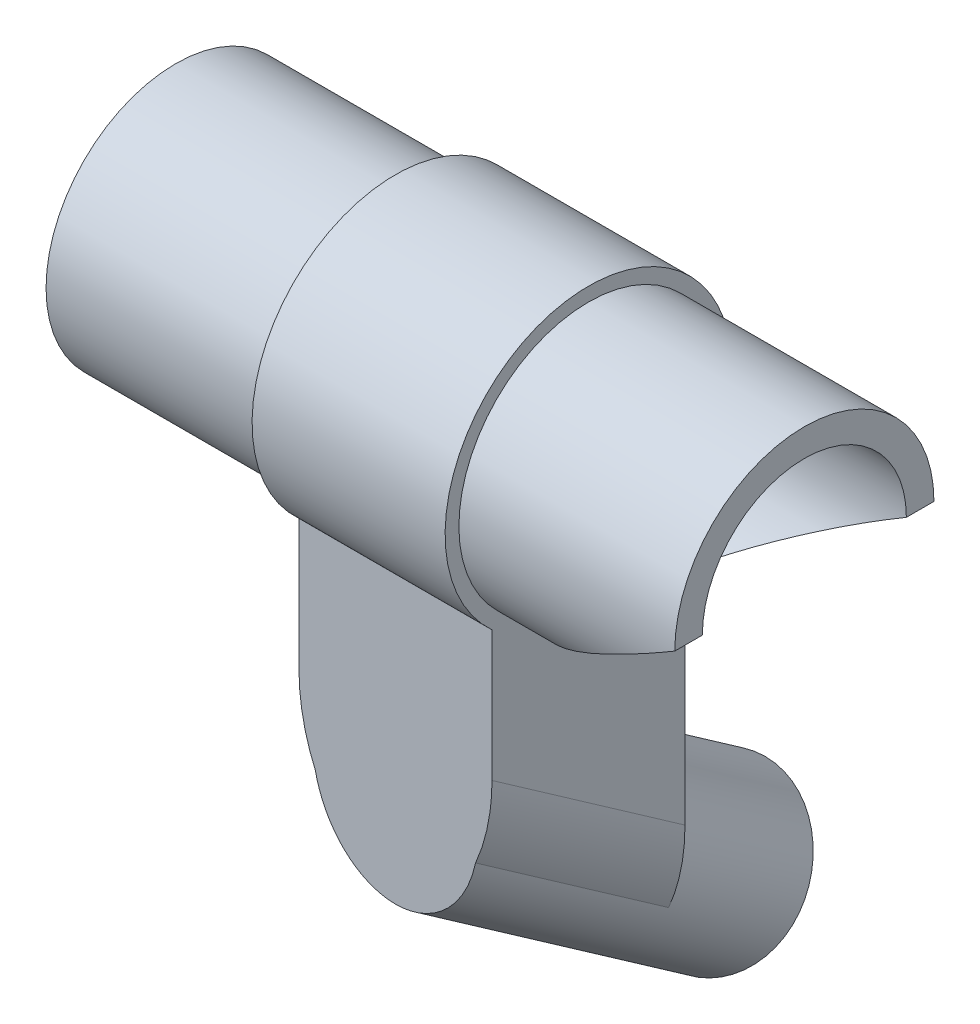
from build123d import *

# Parameters (mm, degrees)
CROQUIS1_R              = 23.5
CROQUIS1_R_2            = 18.5
SALIENTE_EXTRUIR1_DEPTH = 114
CROQUIS2_R              = 23.5
CROQUIS2_R_2            = 5.375
CROQUIS2_R_3            = 1.25
SALIENTE_EXTRUIR2_DEPTH = 5
CORTAR_EXTRUIR1_DEPTH   = 23.5
CROQUIS6_R              = 11.5
CORTAR_EXTRUIR2_DEPTH   = 2.5
CROQUIS17_W             = 35
CROQUIS17_H             = 35
SALIENTE_EXTRUIR3_DEPTH = 65
CROQUIS18_R             = 15
CROQUIS18_R_2           = 12.5
SALIENTE_EXTRUIR4_DEPTH = 70
CROQUIS26_W             = 35
CROQUIS26_H             = 35
SALIENTE_EXTRUIR8_DEPTH = 40
CORTAR_EXTRUIR4_DEPTH   = 167.48351172
CROQUIS27_R             = 26
SALIENTE_EXTRUIR9_DEPTH = 35
CORTAR_EXTRUIR7_START   = -35
CROQUIS28_R             = 18.5
CORTAR_EXTRUIR7_DEPTH   = 35
CROQUIS25_W             = 17.40616007
CROQUIS25_H             = 44.473979809
CORTAR_EXTRUIR8_DEPTH   = 35
REDONDEO7_R             = 25


with BuildPart() as part:
    # Croquis1 → Saliente-Extruir1 (new body)
    with BuildSketch(Plane(origin=(0, 0, 0), x_dir=(0, 0, -1), z_dir=(1, 0, 0))):
        with Locations(Location((0, 0, 0), (0, 0, 180))):
            Circle(CROQUIS1_R)
        with Locations(Location((0, 0, 0), (0, 0, 180))):
            Circle(CROQUIS1_R_2, mode=Mode.SUBTRACT)
    extrude(amount=SALIENTE_EXTRUIR1_DEPTH)

    # Croquis2 → Saliente-Extruir2 (add)
    with BuildSketch(Plane.ZY):
        Circle(CROQUIS2_R)
        Circle(CROQUIS2_R_2, mode=Mode.SUBTRACT)
        with Locations((-12.476232327, 6.351663319)):
            Circle(CROQUIS2_R_3, mode=Mode.SUBTRACT)
        with Locations((-6.351663319, -12.476232327)):
            Circle(CROQUIS2_R_3, mode=Mode.SUBTRACT)
        with Locations((12.476232327, -6.351663319)):
            Circle(CROQUIS2_R_3, mode=Mode.SUBTRACT)
        with Locations((6.351663319, 12.476232327)):
            Circle(CROQUIS2_R_3, mode=Mode.SUBTRACT)
    extrude(amount=-SALIENTE_EXTRUIR2_DEPTH)

    # Croquis4 → Cortar-Extruir1 (cut, symmetric)
    with BuildSketch(Plane.XY):
        Polygon((114, 0), (74, -23.5), (114, -23.5), align=None)
    extrude(amount=CORTAR_EXTRUIR1_DEPTH, both=True, mode=Mode.SUBTRACT)

    # Croquis6 → Cortar-Extruir2 (cut)
    with BuildSketch(Plane(origin=(5, 0, 0), x_dir=(0, 0, -1), z_dir=(1, 0, 0))):
        Circle(CROQUIS6_R)
    extrude(amount=-CORTAR_EXTRUIR2_DEPTH, mode=Mode.SUBTRACT)

    # Croquis17 → Saliente-Extruir3 (add)
    with BuildSketch(Plane(origin=(0, 0, 0), x_dir=(1, 0, 0), z_dir=(0, 1, 0))):
        with Locations((57.357864376, 0)):
            Rectangle(CROQUIS17_W, CROQUIS17_H)
    extrude(amount=-SALIENTE_EXTRUIR3_DEPTH)

    # Croquis18 → Saliente-Extruir4 (add)
    with BuildSketch(Plane(origin=(57.357864376, -93.678821818, -40.957602214), x_dir=(-1, 0, 0), z_dir=(-3.776705924582896e-15, -0.5735764363510474, -0.8191520442889909))):
        with Locations(Location((0, 0, 0), (0, 0, 90))):
            Circle(CROQUIS18_R)
        with Locations(Location((0, 0, 0), (0, 0, 90))):
            Circle(CROQUIS18_R_2, mode=Mode.SUBTRACT)
    extrude(amount=-SALIENTE_EXTRUIR4_DEPTH)

    # Croquis26 → Saliente-Extruir8 (add)
    with BuildSketch(Plane.XZ.offset(65)):
        with Locations((57.357864376, 0)):
            Rectangle(CROQUIS26_W, CROQUIS26_H)
    extrude(amount=SALIENTE_EXTRUIR8_DEPTH)

    # Croquis23 → Cortar-Extruir4 (cut, through all)
    with BuildSketch(Plane(origin=(0, -50.063167159, -71.49761239), x_dir=(-0.9999999349220849, 0.0002955264288911758, -0.00020692983324517575), z_dir=(-3.786088196428006e-15, -0.5735764363510474, -0.819152044288991))):
        with BuildLine():
            Line((-72.377069861, -53.224186351), (-106.285107353, -53.224186351))
            ThreePointArc((-106.285107353, -53.224186351), (-57.377069861, -102.132223842), (-8.46903237, -53.224186351))
            Line((-8.46903237, -53.224186351), (-42.377069861, -53.224186351))
            ThreePointArc((-42.377069861, -53.224186351), (-57.377069861, -68.224186351), (-72.377069861, -53.224186351))
        make_face()
    extrude(amount=-CORTAR_EXTRUIR4_DEPTH, mode=Mode.SUBTRACT)

    # Chaflán1
    # the kernel refuses this chamfer: 5 mm, written as the material it adds along each edge
    with BuildSketch(Plane(origin=(72.3578634, -83.748374972, -26.766019567), x_dir=(0.9996432935674607, 0.021877427608148432, -0.015318739727867424), z_dir=(3.786088196428006e-15, 0.5735764363510474, 0.8191520442889909))) as chafl_n1_piece_1_section:
        with BuildLine():
            Line((4.52468849, 0), (-0.739014204, -3.853882904))
            Line((-0.739014204, -3.853882904), (-0.835126609, -3.826271211))
            ThreePointArc((-0.835126609, -3.826271211), (-0.28053556, -1.941134087), (-0.099963359, 0.002706805))
            Line((-0.099963359, 0.002706805), (0.002706805, 0.099963359))
            ThreePointArc((0.002706805, 0.099963359), (2.263393477, 0.038748553), (4.527395295, 0.099963359))
            Line((4.527395295, 0.099963359), (4.52468849, 0))
        make_face()
    chafl_n1_piece_1 = extrude(amount=65.350553059, mode=Mode.PRIVATE)
    chafl_n1_piece_1 = split(chafl_n1_piece_1, bisect_by=Plane(origin=(74.857864376, -66.861949612, -0.210272202), z_dir=(-1, 0, 0)), keep=Keep.TOP, mode=Mode.PRIVATE)
    chafl_n1_piece_1 = split(chafl_n1_piece_1, bisect_by=Plane(origin=(73.269162948, -66.861949612, -17.5), z_dir=(0, 0, 1)), keep=Keep.TOP, mode=Mode.PRIVATE)
    chafl_n1_piece_1 = split(chafl_n1_piece_1, bisect_by=Plane(origin=(73.269162948, -66.861949612, 17.5), z_dir=(0, 0, -1)), keep=Keep.TOP, mode=Mode.PRIVATE)
    chafl_n1_piece_1 = split(chafl_n1_piece_1, bisect_by=Plane(origin=(73.269162948, -54.679062597, 17.188693604), z_dir=(-3.776705924582896e-15, -0.5735764363510474, -0.8191520442889909)), keep=Keep.TOP, mode=Mode.PRIVATE)
    add(chafl_n1_piece_1)
    with BuildSketch(Plane(origin=(72.3578634, -83.748374972, -26.766019567), x_dir=(0.9996432935674607, 0.021877427608148432, -0.015318739727867424), z_dir=(3.786088196428006e-15, 0.5735764363510474, 0.8191520442889909))) as chafl_n1_piece_2_section:
        with BuildLine():
            Line((4.52468849, 0), (-0.739014204, -3.853882904))
            Line((-0.739014204, -3.853882904), (-0.835126609, -3.826271211))
            ThreePointArc((-0.835126609, -3.826271211), (-0.28053556, -1.941134087), (-0.099963359, 0.002706805))
            Line((-0.099963359, 0.002706805), (0.002706805, 0.099963359))
            ThreePointArc((0.002706805, 0.099963359), (2.263393477, 0.038748553), (4.527395295, 0.099963359))
            Line((4.527395295, 0.099963359), (4.52468849, 0))
        make_face()
    chafl_n1_piece_2 = extrude(amount=65.350553059, mode=Mode.PRIVATE)
    chafl_n1_piece_2 = split(chafl_n1_piece_2, bisect_by=Plane(origin=(72.413190885, -56.144513508, 17.5), z_dir=(0, 0, 1)), keep=Keep.TOP, mode=Mode.PRIVATE)
    chafl_n1_piece_2 = split(chafl_n1_piece_2, bisect_by=Plane(origin=(72.413190885, -55.943525833, 18.074080294), z_dir=(-3.776705924582896e-15, -0.5735764363510474, -0.8191520442889909)), keep=Keep.TOP, mode=Mode.PRIVATE)
    add(chafl_n1_piece_2)
    with BuildSketch(Plane(origin=(72.3578634, -83.748374972, -26.766019567), x_dir=(0.9996432935674607, 0.021877427608148432, -0.015318739727867424), z_dir=(3.786088196428006e-15, 0.5735764363510474, 0.8191520442889909))) as chafl_n1_piece_3_section:
        with BuildLine():
            Line((4.52468849, 0), (-0.739014204, -3.853882904))
            Line((-0.739014204, -3.853882904), (-0.835126609, -3.826271211))
            ThreePointArc((-0.835126609, -3.826271211), (-0.28053556, -1.941134087), (-0.099963359, 0.002706805))
            Line((-0.099963359, 0.002706805), (0.002706805, 0.099963359))
            ThreePointArc((0.002706805, 0.099963359), (2.263393477, 0.038748553), (4.527395295, 0.099963359))
            Line((4.527395295, 0.099963359), (4.52468849, 0))
        make_face()
    chafl_n1_piece_3 = extrude(amount=65.350553059, mode=Mode.PRIVATE)
    chafl_n1_piece_3 = split(chafl_n1_piece_3, bisect_by=Plane(origin=(74.857864376, -53.740671542, 17.111139805), z_dir=(-1, 0, 0)), keep=Keep.TOP, mode=Mode.PRIVATE)
    chafl_n1_piece_3 = split(chafl_n1_piece_3, bisect_by=Plane(origin=(73.550120659, -53.740671542, 17.5), z_dir=(0, 0, -1)), keep=Keep.TOP, mode=Mode.PRIVATE)
    chafl_n1_piece_3 = split(chafl_n1_piece_3, bisect_by=Plane(origin=(73.550120659, -54.012954381, 16.72227961), z_dir=(3.776705924582896e-15, 0.5735764363510474, 0.8191520442889909)), keep=Keep.TOP, mode=Mode.PRIVATE)
    add(chafl_n1_piece_3)
    with BuildSketch(Plane(origin=(42.357865352, -83.735162365, -26.766019567), x_dir=(-0.9996237628252937, 0.022468263900174177, -0.01573244775338249), z_dir=(3.786088196428006e-15, 0.5735764363510474, 0.8191520442889909))) as chafl_n1_piece_4_section:
        with BuildLine():
            Line((4.52468849, 0), (-0.739014204, 3.853882904))
            Line((-0.739014204, 3.853882904), (-0.835126609, 3.826271211))
            ThreePointArc((-0.835126609, 3.826271211), (-0.28053556, 1.941134087), (-0.099963359, -0.002706805))
            Line((-0.099963359, -0.002706805), (0.002706805, -0.099963359))
            ThreePointArc((0.002706805, -0.099963359), (2.263393477, -0.038748553), (4.527395295, -0.099963359))
            Line((4.527395295, -0.099963359), (4.52468849, 0))
        make_face()
    chafl_n1_piece_4 = extrude(amount=65.350553059, mode=Mode.PRIVATE)
    chafl_n1_piece_4 = split(chafl_n1_piece_4, bisect_by=Plane(origin=(41.445758281, -66.849730794, -17.5), z_dir=(0, 0, 1)), keep=Keep.TOP, mode=Mode.PRIVATE)
    chafl_n1_piece_4 = split(chafl_n1_piece_4, bisect_by=Plane(origin=(39.857864376, -66.849730794, -0.212642444), z_dir=(1, 0, 0)), keep=Keep.TOP, mode=Mode.PRIVATE)
    chafl_n1_piece_4 = split(chafl_n1_piece_4, bisect_by=Plane(origin=(41.445758281, -66.849730794, 17.5), z_dir=(0, 0, -1)), keep=Keep.TOP, mode=Mode.PRIVATE)
    chafl_n1_piece_4 = split(chafl_n1_piece_4, bisect_by=Plane(origin=(41.445758281, -54.669749998, 17.182172852), z_dir=(-3.776705924582896e-15, -0.5735764363510474, -0.8191520442889909)), keep=Keep.TOP, mode=Mode.PRIVATE)
    add(chafl_n1_piece_4)
    with BuildSketch(Plane(origin=(42.357865352, -83.735162365, -26.766019567), x_dir=(-0.9996237628252937, 0.022468263900174177, -0.01573244775338249), z_dir=(3.786088196428006e-15, 0.5735764363510474, 0.8191520442889909))) as chafl_n1_piece_5_section:
        with BuildLine():
            Line((4.52468849, 0), (-0.739014204, 3.853882904))
            Line((-0.739014204, 3.853882904), (-0.835126609, 3.826271211))
            ThreePointArc((-0.835126609, 3.826271211), (-0.28053556, 1.941134087), (-0.099963359, -0.002706805))
            Line((-0.099963359, -0.002706805), (0.002706805, -0.099963359))
            ThreePointArc((0.002706805, -0.099963359), (2.263393477, -0.038748553), (4.527395295, -0.099963359))
            Line((4.527395295, -0.099963359), (4.52468849, 0))
        make_face()
    chafl_n1_piece_5 = extrude(amount=65.350553059, mode=Mode.PRIVATE)
    chafl_n1_piece_5 = split(chafl_n1_piece_5, bisect_by=Plane(origin=(42.30505322, -56.139333536, 17.5), z_dir=(0, 0, 1)), keep=Keep.TOP, mode=Mode.PRIVATE)
    chafl_n1_piece_5 = split(chafl_n1_piece_5, bisect_by=Plane(origin=(42.30505322, -55.939365699, 18.071167337), z_dir=(-3.776705924582896e-15, -0.5735764363510474, -0.8191520442889909)), keep=Keep.TOP, mode=Mode.PRIVATE)
    add(chafl_n1_piece_5)
    with BuildSketch(Plane(origin=(42.357865352, -83.735162365, -26.766019567), x_dir=(-0.9996237628252937, 0.022468263900174177, -0.01573244775338249), z_dir=(3.786088196428006e-15, 0.5735764363510474, 0.8191520442889909))) as chafl_n1_piece_6_section:
        with BuildLine():
            Line((4.52468849, 0), (-0.739014204, 3.853882904))
            Line((-0.739014204, 3.853882904), (-0.835126609, 3.826271211))
            ThreePointArc((-0.835126609, 3.826271211), (-0.28053556, 1.941134087), (-0.099963359, -0.002706805))
            Line((-0.099963359, -0.002706805), (0.002706805, -0.099963359))
            ThreePointArc((0.002706805, -0.099963359), (2.263393477, -0.038748553), (4.527395295, -0.099963359))
            Line((4.527395295, -0.099963359), (4.52468849, 0))
        make_face()
    chafl_n1_piece_6 = extrude(amount=65.350553059, mode=Mode.PRIVATE)
    chafl_n1_piece_6 = split(chafl_n1_piece_6, bisect_by=Plane(origin=(39.857864376, -53.732391069, 17.108811543), z_dir=(1, 0, 0)), keep=Keep.TOP, mode=Mode.PRIVATE)
    chafl_n1_piece_6 = split(chafl_n1_piece_6, bisect_by=Plane(origin=(41.16543505, -53.732391069, 17.5), z_dir=(0, 0, -1)), keep=Keep.TOP, mode=Mode.PRIVATE)
    chafl_n1_piece_6 = split(chafl_n1_piece_6, bisect_by=Plane(origin=(41.16543505, -54.006304175, 16.717623086), z_dir=(3.776705924582896e-15, 0.5735764363510474, 0.8191520442889909)), keep=Keep.TOP, mode=Mode.PRIVATE)
    add(chafl_n1_piece_6)

    # Croquis27 → Saliente-Extruir9 (add)
    with BuildSketch(Plane.ZY.offset(-39.857864376)):
        Circle(CROQUIS27_R)
    extrude(amount=-SALIENTE_EXTRUIR9_DEPTH)

    # Croquis28 → Cortar-Extruir7 (cut)
    with BuildSketch(Plane(origin=(74.857864376, 0, 0), x_dir=(0, 0, -1), z_dir=(1, 0, 0)).offset(CORTAR_EXTRUIR7_START)):
        with Locations(Location((0, 0, 0), (0, 0, 180))):
            Circle(CROQUIS28_R)
    extrude(amount=CORTAR_EXTRUIR7_DEPTH, mode=Mode.SUBTRACT)

    # Croquis25 → Cortar-Extruir8 (cut)
    with BuildSketch(Plane.ZY.offset(-39.857864376)):
        with Locations((26.203080035, -59.941786128)):
            Rectangle(CROQUIS25_W, CROQUIS25_H)
    extrude(amount=-CORTAR_EXTRUIR8_DEPTH, mode=Mode.SUBTRACT)

    # Redondeo7
    # the kernel refuses this fillet: 25 mm, written as the material it takes off along each edge
    with BuildSketch(Plane(origin=(74.857864376, -92.687057178, -37.012402739), x_dir=(-0.7907902899042683, -0.5013924657655986, 0.3510787841305944), z_dir=(0, 0.5735764363510114, 0.8191520442890161))) as redondeo7_piece_1:
        with BuildLine():
            CenterArc((13.937730496, -22.836907045), REDONDEO7_R, 114.009742732, 28.249684026)
            Line((-5.832026752, -7.534727515), (-6.227421897, -7.228683925))
            Line((-6.227421897, -7.228683925), (-0.395395145, 0.306043591))
            Line((-0.395395145, 0.306043591), (0, 0.5))
            ThreePointArc((0, 0.5), (1.882715511, 0.5), (3.561985032, 0.456738141))
            Line((3.561985032, 0.456738141), (3.765431021, 0))
        make_face()
    extrude(amount=90.367601464, mode=Mode.SUBTRACT)
    with BuildSketch(Plane(origin=(39.857864376, -40.84904598, 36.999342745), x_dir=(0.7903484372835544, -0.5018597340768438, 0.3514059689244948), z_dir=(0, -0.5735764363510115, -0.819152044289016))) as redondeo7_piece_2:
        with BuildLine():
            CenterArc((13.925156189, -22.841917455), REDONDEO7_R, 113.98150583, 28.236579598)
            Line((-5.833554743, -7.525477193), (-6.228728961, -7.219148388))
            Line((-6.228728961, -7.219148388), (-0.395174219, 0.306328805))
            Line((-0.395174219, 0.306328805), (0, 0.5))
            ThreePointArc((0, 0.5), (1.882056296, 0.5), (3.56089172, 0.456838349))
            Line((3.56089172, 0.456838349), (3.764112592, 0))
        make_face()
    extrude(amount=90.335714849, mode=Mode.SUBTRACT)


solid = part.part
